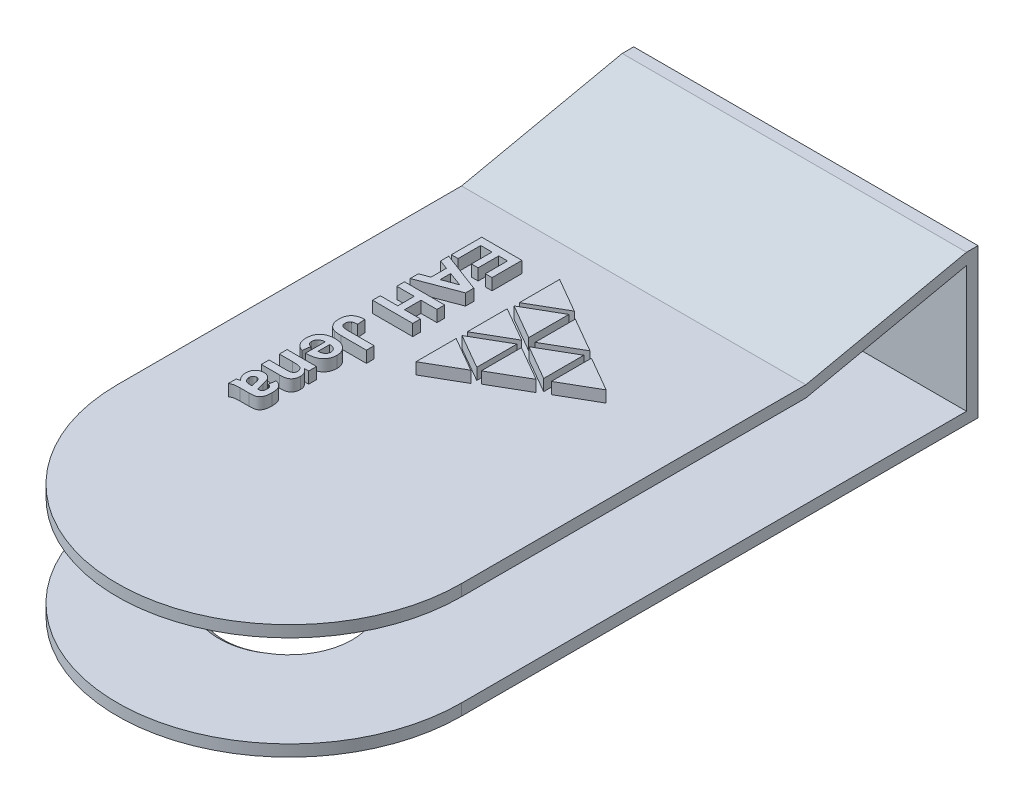
from build123d import *

# Parameters (mm, degrees)
SKIZZE1_W                       = 30
SKIZZE1_H                       = 45
AUFSATZ_LINEAR_AUSTRAGEN1_DEPTH = 1
SKIZZE2_W                       = 30
SKIZZE2_H                       = 1
AUFSATZ_LINEAR_AUSTRAGEN2_DEPTH = 11
SKIZZE3_W                       = 30
SKIZZE3_H                       = 30
AUFSATZ_LINEAR_AUSTRAGEN3_DEPTH = 1
AUFSATZ_LINEAR_AUSTRAGEN4_DEPTH = 30
SKIZZE6_R                       = 8
AUFSATZ_LINEAR_AUSTRAGEN5_DEPTH = 1
SKIZZE7_R                       = 6.3
SCHNITT_LINEAR_AUSTRAGEN1_DEPTH = 2
GEWINDE1_PITCH                  = 1.5
SKIZZE10_R                      = 12.632804719
SCHNITT_LINEAR_AUSTRAGEN2_DEPTH = 5
SKIZZE11_R                      = 16.474015788
SCHNITT_LINEAR_AUSTRAGEN3_DEPTH = 5
AUFSATZ_LINEAR_AUSTRAGEN6_DEPTH = 1
AUFSATZ_LINEAR_AUSTRAGEN7_DEPTH = 1


with BuildPart() as part:
    # Skizze1 → Aufsatz-Linear austragen1 (new body)
    with BuildSketch(Plane(origin=(0, 0, 0), x_dir=(1, 0, 0), z_dir=(0, 1, 0))):
        Rectangle(SKIZZE1_W, SKIZZE1_H)
        with BuildLine():
            ThreePointArc((15, -22.5), (0, -37.5), (-15, -22.5))
            Line((-15, -22.5), (15, -22.5))
        make_face()
    extrude(amount=AUFSATZ_LINEAR_AUSTRAGEN1_DEPTH)

    # Skizze2 → Aufsatz-Linear austragen2 (add)
    with BuildSketch(Plane(origin=(0, 1, 0), x_dir=(1, 0, 0), z_dir=(0, 1, 0))):
        with Locations((0, 22)):
            Rectangle(SKIZZE2_W, SKIZZE2_H)
    extrude(amount=AUFSATZ_LINEAR_AUSTRAGEN2_DEPTH)



with BuildPart() as body_2:
    # Skizze3 → Aufsatz-Linear austragen3 (new body)
    with BuildSketch(Plane(origin=(0, 9, 0), x_dir=(1, 0, 0), z_dir=(0, 1, 0))):
        with Locations((0, -7.5)):
            Rectangle(SKIZZE3_W, SKIZZE3_H)
        with BuildLine():
            ThreePointArc((15, -22.5), (0, -37.5), (-15, -22.5))
            Line((-15, -22.5), (15, -22.5))
        make_face()
    extrude(amount=AUFSATZ_LINEAR_AUSTRAGEN3_DEPTH)


with BuildPart() as part_1:
    add(part.part)

    add(body_2.part)  # Aufsatz-Linear austragen4 merges body 2
    # Skizze5 → Aufsatz-Linear austragen4 (add)
    with BuildSketch(Plane(origin=(15, 0, 0), x_dir=(0, 0, -1), z_dir=(1, 0, 0))):
        Polygon((7.5, 9), (21.5, 12), (22.5, 12), (22.5, 13), (21.5, 13), (7.5, 10), align=None)
    extrude(amount=-AUFSATZ_LINEAR_AUSTRAGEN4_DEPTH)

    # Skizze6 → Aufsatz-Linear austragen5 (add)
    with BuildSketch(Plane.XZ):
        with Locations(Location((0, 22.5, 0), (0, 0, 90))):
            Circle(SKIZZE6_R)
    extrude(amount=AUFSATZ_LINEAR_AUSTRAGEN5_DEPTH)

    # Skizze7 → Schnitt-Linear austragen1 (cut)
    with BuildSketch(Plane(origin=(0, -1, 0), x_dir=(-1, 0, 0), z_dir=(0, -1, 0))):
        with Locations(Location((0, -22.5, 0), (0, 0, 90))):
            Circle(SKIZZE7_R)
    extrude(amount=-SCHNITT_LINEAR_AUSTRAGEN1_DEPTH, mode=Mode.SUBTRACT)

    # Gewinde1: the profile of Gewindeprofil1 profile screwed along a right-hand helix of 2.666667 turns, 8 arcs to a turn; built about Z, then put on its axis
    gewinde1_z = Axis((0, 0, 0), (0, 0, 1))
    gewinde1_corners = [(6.3003, 0, -0.000173205), (6.3003, 0, 1.312673201), (5.488101188, 0, 0.843749998), (5.488101188, 0, 0.468749998)]
    with BuildLine(mode=Mode.PRIVATE) as gewinde1_profile:
        Line(gewinde1_corners[0], gewinde1_corners[1])
        Line(gewinde1_corners[1], gewinde1_corners[2])
        Line(gewinde1_corners[2], gewinde1_corners[3])
        Line(gewinde1_corners[3], gewinde1_corners[0])
    gewinde1_cap = Face(gewinde1_profile.wire())
    gewinde1_turn_angles = [0, 22.5, 45, 67.5, 90, 112.5, 135, 157.5, 180, 202.5, 225, 247.5, 270, 292.5, 315, 337.5, 360]
    gewinde1_turn_weights = [1, 0.9238795325112867, 1, 0.9238795325112867, 1, 0.9238795325112867, 1, 0.9238795325112867, 1, 0.9238795325112867, 1, 0.9238795325112867, 1, 0.9238795325112867, 1, 0.9238795325112867, 1]
    gewinde1_turn_rails = [Edge.make_bspline([Vector(p[0], p[1], 0).rotate(gewinde1_z, gewinde1_turn_angles[k]) / gewinde1_turn_weights[k] + Vector(0, 0, p[2] + GEWINDE1_PITCH * gewinde1_turn_angles[k] / 360) for k in range(17)], [0, 0, 0, 1, 1, 2, 2, 3, 3, 4, 4, 5, 5, 6, 6, 7, 7, 8, 8, 8], 2, gewinde1_turn_weights) for p in gewinde1_corners]
    gewinde1_turn_sides = [Face.make_surface_from_curves(gewinde1_turn_rails[p[0]], gewinde1_turn_rails[p[1]]) for p in [(0, 1), (1, 2), (2, 3), (3, 0)]]
    gewinde1_last_angles = [720, 742.5, 765, 787.5, 810, 832.5, 855, 877.5, 900, 922.5, 945, 952.5, 960]
    gewinde1_last_weights = [1, 0.9238795325112867, 1, 0.9238795325112867, 1, 0.9238795325112867, 1, 0.9238795325112867, 1, 0.9238795325112867, 1, 0.9914448613738105, 1]
    gewinde1_last_rails = [Edge.make_bspline([Vector(p[0], p[1], 0).rotate(gewinde1_z, gewinde1_last_angles[k]) / gewinde1_last_weights[k] + Vector(0, 0, p[2] + GEWINDE1_PITCH * gewinde1_last_angles[k] / 360) for k in range(13)], [0, 0, 0, 1, 1, 2, 2, 3, 3, 4, 4, 5, 5, 6, 6, 6], 2, gewinde1_last_weights) for p in gewinde1_corners]
    gewinde1_last_sides = [Face.make_surface_from_curves(gewinde1_last_rails[p[0]], gewinde1_last_rails[p[1]]) for p in [(0, 1), (1, 2), (2, 3), (3, 0)]]
    gewinde1 = Plane(origin=(0, -2.6, 22.5), x_dir=(1, 0, 0), z_dir=(0, 1, 0)) * Solid(Shell([*[p.moved(Location((0, 0, GEWINDE1_PITCH * i))) for i in range(2) for p in gewinde1_turn_sides], *gewinde1_last_sides, gewinde1_cap, gewinde1_cap.rotate(gewinde1_z, 960).moved(Location((0, 0, GEWINDE1_PITCH * 960 / 360)))]))
    add(gewinde1)

    # Skizze10 → Schnitt-Linear austragen2 (cut)
    with BuildSketch(Plane.XZ.offset(1)):
        with Locations((0, 22.5)):
            Circle(SKIZZE10_R)
    extrude(amount=SCHNITT_LINEAR_AUSTRAGEN2_DEPTH, mode=Mode.SUBTRACT)

    # Skizze11 → Schnitt-Linear austragen3 (cut)
    with BuildSketch(Plane(origin=(0, 1, 0), x_dir=(1, 0, 0), z_dir=(0, 1, 0))):
        with Locations((0.314523005, -22.5)):
            Circle(SKIZZE11_R)
    extrude(amount=SCHNITT_LINEAR_AUSTRAGEN3_DEPTH, mode=Mode.SUBTRACT)

    # Skizze13 → Aufsatz-Linear austragen6 (add)
    # profile 1 of 7: a face of its own
    with BuildSketch(Plane(origin=(0, 10, 0), x_dir=(1, 0, 0), z_dir=(0, 1, 0))):
        with BuildLine():
            Line((-7.461538462, -16.855769231), (-7.371794872, -16.272435897))
            add(Edge.make_bspline(
                [(-7.371794872, -16.272435897), (-7.342228568, -16.281177988), (-7.284353131, -16.298290453), (-7.201417105, -16.329692101), (-7.124742821, -16.366463113), (-7.053414279, -16.407016325), (-6.988211238, -16.452601317), (-6.928964081, -16.502489503), (-6.87587558, -16.556962832), (-6.828534738, -16.616281643), (-6.78648002, -16.681587167), (-6.750825989, -16.754361852), (-6.720804789, -16.834496629), (-6.696678262, -16.921878985), (-6.676507552, -17.016362316), (-6.664159349, -17.118669812), (-6.655245863, -17.228141607), (-6.654321879, -17.303531989), (-6.653846154, -17.342347756)],
                knots=[0, 0, 0, 0, 1.047140172, 2.049755565, 3.008539736, 3.933190086, 4.833981818, 5.707167246, 6.560530269, 7.413560864, 8.281243119, 9.193714071, 10.161006392, 11.183910126, 12.270717139, 13.439589873, 14.681737877, 16, 16, 16, 16], degree=3))
            add(Edge.make_bspline(
                [(-6.653846154, -17.342347756), (-6.654040458, -17.377644162), (-6.654416405, -17.445937161), (-6.659409822, -17.544869412), (-6.667464028, -17.636617681), (-6.679750029, -17.721457439), (-6.693817921, -17.799572387), (-6.712099932, -17.870796197), (-6.733529165, -17.93496193), (-6.766861986, -18.009101075), (-6.813711555, -18.090520093), (-6.877263393, -18.175577918), (-6.949862734, -18.243647865), (-7.017034313, -18.28945705), (-7.078235395, -18.316410266), (-7.132561048, -18.333813561), (-7.195063387, -18.34914792), (-7.266650154, -18.360460763), (-7.346098661, -18.370614864), (-7.434603024, -18.376239354), (-7.531370038, -18.38075665), (-7.59895166, -18.381186988), (-7.634014423, -18.381410256)],
                knots=[0, 0, 0, 0, 1.253089278, 2.424530831, 3.516103812, 4.521791402, 5.467348922, 6.332758186, 7.130477226, 7.865998692, 9.215316109, 10.458392318, 11.620687606, 12.7345829, 13.32519123, 13.989073223, 14.757870489, 15.607744835, 16.560809343, 17.600728964, 18.755207866, 20, 20, 20, 20], degree=3))
            Line((-7.634014423, -18.381410256), (-8.419971955, -18.381410256))
            add(Edge.make_bspline(
                [(-8.419971955, -18.381410256), (-8.447080442, -18.38163882), (-8.499431254, -18.382080213), (-8.575204963, -18.38280215), (-8.645254702, -18.387187846), (-8.709880154, -18.389714647), (-8.768944245, -18.395940559), (-8.822574056, -18.40172905), (-8.870770752, -18.409499087), (-8.928361612, -18.421761672), (-8.998019943, -18.441867703), (-9.082273661, -18.472969466), (-9.168931941, -18.513158905), (-9.226671678, -18.544668545), (-9.256410256, -18.560897436)],
                knots=[0, 0, 0, 0, 1.124133555, 2.170881208, 3.141136401, 4.03397314, 4.851653906, 5.602897914, 6.270414243, 6.874806075, 8.043499627, 9.272964875, 10.595453442, 12, 12, 12, 12], degree=3))
            Line((-9.256410256, -18.560897436), (-9.256410256, -17.887820513))
            add(Edge.make_bspline(
                [(-9.256410256, -17.887820513), (-9.242897242, -17.883016373), (-9.213287459, -17.872489517), (-9.163653559, -17.858272961), (-9.105824046, -17.841235347), (-9.064095786, -17.83000231), (-9.041866987, -17.824018429)],
                knots=[0, 0, 0, 0, 0.768508203, 1.683958961, 2.766236402, 4, 4, 4, 4], degree=3))
            add(Edge.make_bspline(
                [(-9.041866987, -17.824018429), (-9.032014411, -17.821579315), (-9.014119373, -17.817149199), (-8.990388596, -17.809388151), (-8.97155602, -17.805294393), (-8.961216976, -17.801654063), (-8.95703125, -17.800180288)],
                knots=[0, 0, 0, 0, 1.38134116, 2.508902287, 3.396334264, 4, 4, 4, 4], degree=3))
            add(Edge.make_bspline(
                [(-8.95703125, -17.800180288), (-8.984483486, -17.771706237), (-9.0382029, -17.715987303), (-9.10777297, -17.625113764), (-9.167671581, -17.53227479), (-9.216528902, -17.435953528), (-9.254891933, -17.336694325), (-9.281193716, -17.23381568), (-9.298031659, -17.127889616), (-9.300190492, -17.056120156), (-9.301282051, -17.019831731)],
                knots=[0, 0, 0, 0, 1.082278699, 2.117837564, 3.127951196, 4.103896207, 5.070141411, 6.035602179, 7.006751569, 8, 8, 8, 8], degree=3))
            add(Edge.make_bspline(
                [(-9.301282051, -17.019831731), (-9.300551328, -16.988261576), (-9.299124118, -16.926600357), (-9.289695712, -16.836623652), (-9.271815335, -16.752045612), (-9.248030246, -16.672484102), (-9.218145083, -16.597727557), (-9.180534672, -16.528488617), (-9.136417111, -16.464261666), (-9.084873908, -16.406412303), (-9.029167654, -16.353877064), (-8.969265829, -16.308052451), (-8.905712194, -16.269006303), (-8.838305422, -16.237687717), (-8.767453749, -16.212697126), (-8.693135324, -16.195520674), (-8.615209989, -16.184555758), (-8.562103969, -16.183322669), (-8.534955929, -16.182692308)],
                knots=[0, 0, 0, 0, 1.18658458, 2.31757657, 3.394226474, 4.430715881, 5.435456892, 6.414057866, 7.386212409, 8.35709637, 9.320281587, 10.260156395, 11.186596348, 12.117853754, 13.048448167, 14.005042754, 14.980168739, 16, 16, 16, 16], degree=3))
            add(Edge.make_bspline(
                [(-8.534955929, -16.182692308), (-8.499362275, -16.183939807), (-8.429562987, -16.186386157), (-8.327694138, -16.204577763), (-8.232177791, -16.23673606), (-8.142928174, -16.280105499), (-8.06149932, -16.334583062), (-7.989631341, -16.400003093), (-7.928168256, -16.475615445), (-7.876606032, -16.563377641), (-7.832723617, -16.665636684), (-7.790287228, -16.784863762), (-7.752647697, -16.924314043), (-7.730998836, -17.024399966), (-7.719551282, -17.077323718)],
                knots=[0, 0, 0, 0, 0.956565251, 1.875828012, 2.769799286, 3.657635185, 4.535794535, 5.394066738, 6.260416921, 7.14495727, 8.120882861, 9.247498621, 10.544523601, 12, 12, 12, 12], degree=3))
            add(Edge.make_bspline(
                [(-7.719551282, -17.077323718), (-7.712132971, -17.113794602), (-7.697852982, -17.183999772), (-7.676337014, -17.284834233), (-7.654863859, -17.376776028), (-7.63247901, -17.45969484), (-7.612876557, -17.534591783), (-7.592592957, -17.600571463), (-7.572345631, -17.657613361), (-7.557957507, -17.692259194), (-7.551282051, -17.708333333)],
                knots=[0, 0, 0, 0, 1.365617471, 2.628765604, 3.783168753, 4.829402825, 5.780074121, 6.623651276, 7.361434847, 8, 8, 8, 8], degree=3))
            Line((-7.551282051, -17.708333333), (-7.487479968, -17.708333333))
            add(Edge.make_bspline(
                [(-7.487479968, -17.708333333), (-7.458881578, -17.707430868), (-7.405772743, -17.705754939), (-7.332057391, -17.689262951), (-7.271720541, -17.660371446), (-7.230837496, -17.626426085), (-7.206638597, -17.592123281), (-7.190200311, -17.561669993), (-7.177581988, -17.525784147), (-7.165905401, -17.485396417), (-7.158100407, -17.439751277), (-7.151571999, -17.389253402), (-7.148378817, -17.333739962), (-7.147758794, -17.295141434), (-7.147435897, -17.275040064)],
                knots=[0, 0, 0, 0, 1.600017626, 2.971323677, 4.194571328, 5.31736933, 5.898517236, 6.536691297, 7.248930295, 8.023708211, 8.888724419, 9.83830628, 10.874231527, 12, 12, 12, 12], degree=3))
            add(Edge.make_bspline(
                [(-7.147435897, -17.275040064), (-7.148105155, -17.248336308), (-7.14938268, -17.197362324), (-7.162610143, -17.125735408), (-7.184310446, -17.062932274), (-7.21586982, -17.008539641), (-7.259037342, -16.961516134), (-7.314665433, -16.92056097), (-7.383036587, -16.884282018), (-7.434386761, -16.865631042), (-7.461538462, -16.855769231)],
                knots=[0, 0, 0, 0, 1.120624541, 2.139125895, 3.045753857, 3.899333821, 4.761059621, 5.707367731, 6.787757473, 8, 8, 8, 8], degree=3))
        make_face()
        with BuildLine():
            add(Edge.make_bspline(
                [(-8.044871795, -17.708333333), (-8.052008257, -17.685233208), (-8.068081471, -17.63320557), (-8.091569637, -17.546016977), (-8.116693521, -17.440970365), (-8.138009131, -17.344010664), (-8.155711696, -17.262741023), (-8.169576028, -17.205422407), (-8.183799139, -17.153808711), (-8.197454974, -17.107864753), (-8.211613494, -17.067422328), (-8.225531669, -17.032878753), (-8.238365234, -17.003286764), (-8.248936791, -16.986772978), (-8.25380609, -16.979166667)],
                knots=[0, 0, 0, 0, 1.144251806, 2.577159925, 4.272729571, 6.25595871, 7.275767821, 8.209390473, 9.046628288, 9.809462825, 10.477647263, 11.07332096, 11.573168194, 12, 12, 12, 12], degree=3))
            add(Edge.make_bspline(
                [(-8.25380609, -16.979166667), (-8.268632797, -16.960341609), (-8.297087078, -16.924214), (-8.352074366, -16.884830719), (-8.413035927, -16.859839552), (-8.456189511, -16.857142619), (-8.478165064, -16.855769231)],
                knots=[0, 0, 0, 0, 1.075028234, 2.063111864, 3.013658082, 4, 4, 4, 4], degree=3))
            add(Edge.make_bspline(
                [(-8.478165064, -16.855769231), (-8.500030113, -16.856980636), (-8.542920059, -16.8593569), (-8.604725482, -16.878281742), (-8.661337979, -16.910111518), (-8.711708385, -16.953441844), (-8.75501993, -17.0054995), (-8.785449465, -17.066730628), (-8.804289489, -17.134643152), (-8.80653276, -17.182364207), (-8.807692308, -17.20703125)],
                knots=[0, 0, 0, 0, 0.97671936, 1.915908908, 2.861187175, 3.862381481, 4.872972798, 5.868749731, 6.898355403, 8, 8, 8, 8], degree=3))
            add(Edge.make_bspline(
                [(-8.807692308, -17.20703125), (-8.80641627, -17.235231993), (-8.803847367, -17.292005414), (-8.780375313, -17.375271116), (-8.7457309, -17.457480238), (-8.711634914, -17.507397088), (-8.694110577, -17.533052885)],
                knots=[0, 0, 0, 0, 0.962503947, 1.937702252, 2.940039444, 4, 4, 4, 4], degree=3))
            add(Edge.make_bspline(
                [(-8.694110577, -17.533052885), (-8.679523572, -17.551171955), (-8.651161485, -17.586401576), (-8.599332491, -17.628390335), (-8.544198801, -17.663040369), (-8.503525788, -17.676849831), (-8.483072917, -17.683794071)],
                knots=[0, 0, 0, 0, 1.055399509, 2.052054707, 3.020454315, 4, 4, 4, 4], degree=3))
            add(Edge.make_bspline(
                [(-8.483072917, -17.683794071), (-8.466300179, -17.687621301), (-8.427037401, -17.696580346), (-8.357917039, -17.70290117), (-8.270950301, -17.708014319), (-8.206845082, -17.708220524), (-8.17177484, -17.708333333)],
                knots=[0, 0, 0, 0, 0.659054705, 1.542760655, 2.655710416, 4, 4, 4, 4], degree=3))
            Line((-8.17177484, -17.708333333), (-8.044871795, -17.708333333))
        make_face(mode=Mode.SUBTRACT)
    # profile 2 of 7: a face of its own
    with BuildSketch(Plane(origin=(0, 10, 0), x_dir=(1, 0, 0), z_dir=(0, 1, 0))):
        with BuildLine():
            Line((-9.256410256, -15.689102564), (-9.256410256, -15.016025641))
            Line((-9.256410256, -15.016025641), (-7.943910256, -15.016025641))
            add(Edge.make_bspline(
                [(-7.943910256, -15.016025641), (-7.910721892, -15.015925334), (-7.847376132, -15.015733879), (-7.757166968, -15.013384233), (-7.676040389, -15.010873271), (-7.604261412, -15.006770224), (-7.541333264, -15.001328948), (-7.487813208, -14.994300447), (-7.443189581, -14.987084715), (-7.396757732, -14.975097512), (-7.347814596, -14.955607704), (-7.296662138, -14.925600379), (-7.251427054, -14.890512349), (-7.214393717, -14.848100193), (-7.184538177, -14.800544647), (-7.162526665, -14.748336453), (-7.149673429, -14.691086988), (-7.148196886, -14.651508139), (-7.147435897, -14.631109776)],
                knots=[0, 0, 0, 0, 1.58488548, 3.025029391, 4.309307756, 5.460828077, 6.458151993, 7.324757442, 8.038530954, 8.61512886, 9.612015531, 10.54232765, 11.439998968, 12.333497636, 13.216055091, 14.111503416, 15.026696281, 16, 16, 16, 16], degree=3))
            add(Edge.make_bspline(
                [(-7.147435897, -14.631109776), (-7.148748817, -14.604851046), (-7.151334312, -14.553140505), (-7.168933091, -14.477349195), (-7.20079289, -14.406828043), (-7.242564177, -14.340697963), (-7.295066383, -14.282425502), (-7.355540168, -14.231951218), (-7.424799526, -14.192922072), (-7.489155052, -14.16848051), (-7.54744887, -14.154013921), (-7.600092432, -14.144161817), (-7.661521631, -14.137105487), (-7.731109175, -14.129651443), (-7.809510771, -14.125446929), (-7.895950085, -14.120755381), (-7.991112861, -14.119028067), (-8.057258557, -14.118740248), (-8.091846955, -14.118589744)],
                knots=[0, 0, 0, 0, 1.03258592, 2.033440909, 3.037455237, 4.062282952, 5.09715643, 6.109088545, 7.14636667, 8.207988388, 8.805331503, 9.506478866, 10.312364985, 11.235937909, 12.258042538, 13.39892264, 14.639864631, 16, 16, 16, 16], degree=3))
            Line((-8.091846955, -14.118589744), (-9.256410256, -14.118589744))
            Line((-9.256410256, -14.118589744), (-9.256410256, -13.445512821))
            Line((-9.256410256, -13.445512821), (-6.698717949, -13.445512821))
            Line((-6.698717949, -13.445512821), (-6.698717949, -14.118589744))
            Line((-6.698717949, -14.118589744), (-7.067508013, -14.118589744))
            add(Edge.make_bspline(
                [(-7.067508013, -14.118589744), (-7.034720531, -14.144611736), (-6.970847536, -14.195304945), (-6.885959251, -14.280174612), (-6.813917938, -14.370059445), (-6.755111388, -14.465364813), (-6.709718612, -14.566041826), (-6.677748575, -14.671629371), (-6.657066673, -14.782214472), (-6.654932344, -14.857712038), (-6.653846154, -14.896133814)],
                knots=[0, 0, 0, 0, 1.096260936, 2.135615983, 3.138008533, 4.108575778, 5.062498258, 6.023394349, 6.994077526, 8, 8, 8, 8], degree=3))
            add(Edge.make_bspline(
                [(-6.653846154, -14.896133814), (-6.654688482, -14.929852557), (-6.65634727, -14.99625455), (-6.672488329, -15.093537606), (-6.697454412, -15.186500791), (-6.7324294, -15.273626167), (-6.774934934, -15.35322407), (-6.823183682, -15.423942436), (-6.87742841, -15.484408608), (-6.938011924, -15.533906073), (-7.002997177, -15.574443554), (-7.071804537, -15.608529408), (-7.144822629, -15.635886291), (-7.224450591, -15.656752106), (-7.314654488, -15.670971486), (-7.419449471, -15.682280595), (-7.541404293, -15.687993064), (-7.628401155, -15.688717303), (-7.674679487, -15.689102564)],
                knots=[0, 0, 0, 0, 1.087237855, 2.141086966, 3.172903477, 4.188189852, 5.163243972, 6.07948016, 6.944405198, 7.774811094, 8.594983603, 9.411159232, 10.2487933, 11.106686982, 12.062567107, 13.192689343, 14.506639757, 16, 16, 16, 16], degree=3))
            Line((-7.674679487, -15.689102564), (-9.256410256, -15.689102564))
        make_face()
    # profile 3 of 7: a face of its own
    with BuildSketch(Plane(origin=(0, 10, 0), x_dir=(1, 0, 0), z_dir=(0, 1, 0))):
        with BuildLine():
            Line((-8.448717949, -12.189102564), (-8.538461538, -12.862179487))
            add(Edge.make_bspline(
                [(-8.538461538, -12.862179487), (-8.568787149, -12.851170374), (-8.628413763, -12.829524109), (-8.713434132, -12.789976243), (-8.792784786, -12.745769512), (-8.866889692, -12.697116444), (-8.935845536, -12.644198103), (-8.998201779, -12.585264683), (-9.056279736, -12.523187147), (-9.107313924, -12.455368816), (-9.153210578, -12.383508974), (-9.193369664, -12.307246491), (-9.226075661, -12.225971481), (-9.25346472, -12.140914709), (-9.275326702, -12.051690093), (-9.290610376, -11.957933615), (-9.299896286, -11.859765562), (-9.300814309, -11.792755906), (-9.301282051, -11.758613782)],
                knots=[0, 0, 0, 0, 1.071172907, 2.106154283, 3.1104349, 4.085737425, 5.048416355, 5.993087888, 6.932482331, 7.868664062, 8.80754521, 9.762367971, 10.726735429, 11.713584758, 12.728370439, 13.774815933, 14.866245336, 16, 16, 16, 16], degree=3))
            add(Edge.make_bspline(
                [(-9.301282051, -11.758613782), (-9.299961745, -11.705262395), (-9.29739781, -11.601658062), (-9.276895213, -11.451743641), (-9.243220642, -11.312375958), (-9.196897811, -11.183325495), (-9.134829308, -11.065629138), (-9.060341781, -10.958404764), (-8.972113427, -10.861546489), (-8.903837495, -10.807244243), (-8.869391026, -10.779847756)],
                knots=[0, 0, 0, 0, 1.15090686, 2.234973544, 3.257507168, 4.240282073, 5.185422152, 6.119941203, 7.051475585, 8, 8, 8, 8], degree=3))
            add(Edge.make_bspline(
                [(-8.869391026, -10.779847756), (-8.840073177, -10.759636155), (-8.781035589, -10.718935891), (-8.685409387, -10.668235896), (-8.584178597, -10.625293635), (-8.477865017, -10.589425528), (-8.365451188, -10.562213512), (-8.247613825, -10.542534452), (-8.123840194, -10.531534691), (-8.039517262, -10.529754457), (-7.996494391, -10.528846154)],
                knots=[0, 0, 0, 0, 0.924739034, 1.862154457, 2.806332648, 3.78003102, 4.774289357, 5.808656063, 6.881942244, 8, 8, 8, 8], degree=3))
            add(Edge.make_bspline(
                [(-7.996494391, -10.528846154), (-7.945506085, -10.529695292), (-7.845854688, -10.531354846), (-7.70070706, -10.546976564), (-7.563900579, -10.572653055), (-7.43599263, -10.609079301), (-7.316379831, -10.655549182), (-7.20519299, -10.712191224), (-7.102725726, -10.780034423), (-7.009792902, -10.857832035), (-6.92653693, -10.943403101), (-6.853118689, -11.034363206), (-6.791808901, -11.131517511), (-6.74063331, -11.233386819), (-6.702328131, -11.341674603), (-6.674130253, -11.455023298), (-6.656958182, -11.573929115), (-6.654894377, -11.655024806), (-6.653846154, -11.696213942)],
                knots=[0, 0, 0, 0, 1.22208028, 2.38843015, 3.495001974, 4.555551, 5.572102979, 6.566928721, 7.541284444, 8.51191166, 9.466805643, 10.399597494, 11.308905182, 12.215983304, 13.126946664, 14.056451325, 15.012856426, 16, 16, 16, 16], degree=3))
            add(Edge.make_bspline(
                [(-6.653846154, -11.696213942), (-6.654820842, -11.742312924), (-6.656728203, -11.832523801), (-6.674633609, -11.964051338), (-6.703758804, -12.088234433), (-6.745604427, -12.204674528), (-6.79809638, -12.314105277), (-6.863077674, -12.415806737), (-6.940383725, -12.509558017), (-7.028566011, -12.596216033), (-7.129608768, -12.672958221), (-7.242836003, -12.739247195), (-7.368558666, -12.794512274), (-7.50663564, -12.839397424), (-7.657454783, -12.872558378), (-7.820594752, -12.895254643), (-7.996049061, -12.908196353), (-8.117066236, -12.907440931), (-8.179487179, -12.907051282)],
                knots=[0, 0, 0, 0, 0.994914541, 1.946943474, 2.860007193, 3.744253739, 4.613162343, 5.475451996, 6.343187588, 7.231728884, 8.139057486, 9.075471918, 10.058180036, 11.098621179, 12.205332334, 13.387827392, 14.65263521, 16, 16, 16, 16], degree=3))
            Line((-8.179487179, -12.907051282), (-8.179487179, -11.201923077))
            add(Edge.make_bspline(
                [(-8.179487179, -11.201923077), (-8.203575679, -11.203035136), (-8.250483713, -11.205200673), (-8.319094779, -11.213229113), (-8.383087663, -11.227714628), (-8.443754476, -11.244755909), (-8.499504694, -11.268024193), (-8.551458066, -11.295627972), (-8.599333934, -11.327865087), (-8.642641825, -11.365004779), (-8.681062348, -11.405708244), (-8.714878734, -11.448628066), (-8.744153694, -11.493638357), (-8.767194599, -11.541848436), (-8.785642462, -11.592267213), (-8.798003322, -11.645264938), (-8.806040434, -11.700409822), (-8.807134146, -11.738018469), (-8.807692308, -11.757211538)],
                knots=[0, 0, 0, 0, 1.231638706, 2.398395625, 3.522289669, 4.579947828, 5.613000372, 6.600997726, 7.58103015, 8.554716894, 9.508889492, 10.435482506, 11.342805004, 12.245087657, 13.158904806, 14.079635201, 15.019967576, 16, 16, 16, 16], degree=3))
            add(Edge.make_bspline(
                [(-8.807692308, -11.757211538), (-8.806559527, -11.782758898), (-8.804365499, -11.832240322), (-8.788993068, -11.903564467), (-8.761902756, -11.968279163), (-8.724135646, -12.027062518), (-8.673980876, -12.079367997), (-8.610098642, -12.123220722), (-8.534483277, -12.161562415), (-8.478247023, -12.179620468), (-8.448717949, -12.189102564)],
                knots=[0, 0, 0, 0, 1.004430367, 1.945431754, 2.851730883, 3.749038912, 4.678525969, 5.68064125, 6.782128749, 8, 8, 8, 8], degree=3))
        make_face()
        with BuildLine():
            add(Edge.make_bspline(
                [(-7.775641026, -12.233974359), (-7.750851307, -12.23282457), (-7.702571598, -12.230585277), (-7.632223712, -12.22310711), (-7.56643029, -12.210878432), (-7.505709739, -12.192835649), (-7.449246827, -12.172015785), (-7.397025832, -12.14695615), (-7.349781098, -12.116686563), (-7.307896431, -12.081888005), (-7.269587596, -12.045218126), (-7.237787709, -12.004646674), (-7.209013446, -11.963554963), (-7.186817343, -11.919692638), (-7.168848137, -11.874244594), (-7.156254643, -11.826732323), (-7.149348426, -11.777043744), (-7.148080457, -11.743442848), (-7.147435897, -11.726362179)],
                knots=[0, 0, 0, 0, 1.317155349, 2.565252013, 3.752617023, 4.863710936, 5.923691592, 6.944619286, 7.932291025, 8.893346204, 9.832040666, 10.740742434, 11.625065814, 12.490654946, 13.343074709, 14.215747339, 15.092993572, 16, 16, 16, 16], degree=3))
            add(Edge.make_bspline(
                [(-7.147435897, -11.726362179), (-7.148028374, -11.708109846), (-7.149195878, -11.672142712), (-7.156813628, -11.619397982), (-7.170325035, -11.569403702), (-7.188612042, -11.521778865), (-7.212694115, -11.476625533), (-7.242227806, -11.433942696), (-7.276843359, -11.393569778), (-7.303068423, -11.369243245), (-7.31640625, -11.356870994)],
                knots=[0, 0, 0, 0, 1.043516863, 2.056302107, 3.038302912, 3.998520634, 4.966791607, 5.956307719, 6.960596886, 8, 8, 8, 8], degree=3))
            add(Edge.make_bspline(
                [(-7.31640625, -11.356870994), (-7.330908397, -11.345345088), (-7.360045017, -11.322188108), (-7.408317374, -11.292713426), (-7.46013981, -11.26743649), (-7.516044545, -11.246988642), (-7.575719556, -11.231669853), (-7.639101955, -11.221447048), (-7.70609353, -11.214941838), (-7.752020677, -11.214215634), (-7.775641026, -11.213842147)],
                knots=[0, 0, 0, 0, 0.903766344, 1.81577923, 2.754803886, 3.715080786, 4.716965023, 5.758108642, 6.846994466, 8, 8, 8, 8], degree=3))
            Line((-7.775641026, -11.213842147), (-7.775641026, -12.233974359))
        make_face(mode=Mode.SUBTRACT)
    # profile 4 of 7: a face of its own
    with BuildSketch(Plane(origin=(0, 10, 0), x_dir=(1, 0, 0), z_dir=(0, 1, 0))):
        with BuildLine():
            Line((-5.756410256, -9.362179487), (-5.756410256, -10.03525641))
            Line((-5.756410256, -10.03525641), (-7.962840545, -10.03525641))
            add(Edge.make_bspline(
                [(-7.962840545, -10.03525641), (-7.997899929, -10.034955629), (-8.065932917, -10.034371961), (-8.164817907, -10.030785595), (-8.257435375, -10.025449687), (-8.343772027, -10.017241225), (-8.423641224, -10.005675036), (-8.497680061, -9.993417289), (-8.565514333, -9.978534904), (-8.607952171, -9.965198687), (-8.628205128, -9.958834135)],
                knots=[0, 0, 0, 0, 1.251619961, 2.428777588, 3.532126049, 4.56323557, 5.523704531, 6.412540087, 7.242403515, 8, 8, 8, 8], degree=3))
            add(Edge.make_bspline(
                [(-8.628205128, -9.958834135), (-8.653162082, -9.949939392), (-8.702553335, -9.932336183), (-8.773011434, -9.898125034), (-8.839701889, -9.858768979), (-8.902981366, -9.814447529), (-8.962723896, -9.765426416), (-9.018450781, -9.710937041), (-9.070537905, -9.651340927), (-9.117922934, -9.585853087), (-9.162015334, -9.515947187), (-9.198981141, -9.439575419), (-9.230453259, -9.358158007), (-9.256472369, -9.271428903), (-9.276650153, -9.179306279), (-9.291372637, -9.081896651), (-9.299729699, -8.979047579), (-9.300755996, -8.90880247), (-9.301282051, -8.872796474)],
                knots=[0, 0, 0, 0, 0.925423698, 1.831466936, 2.732229661, 3.629578708, 4.52900719, 5.430103168, 6.350647525, 7.291692347, 8.252765748, 9.235429742, 10.251737562, 11.300896807, 12.396835199, 13.545097772, 14.74167469, 16, 16, 16, 16], degree=3))
            add(Edge.make_bspline(
                [(-9.301282051, -8.872796474), (-9.300264761, -8.830695845), (-9.298287057, -8.748848423), (-9.285150064, -8.629829036), (-9.262191518, -8.518206105), (-9.228968293, -8.414356855), (-9.187956748, -8.317260625), (-9.136085543, -8.228401373), (-9.075718065, -8.146532898), (-9.005710517, -8.072504186), (-8.927090237, -8.00634991), (-8.839152606, -7.949168336), (-8.742596276, -7.900927799), (-8.637687155, -7.860772836), (-8.523907441, -7.83021369), (-8.401765926, -7.807881697), (-8.270922148, -7.794633463), (-8.180920068, -7.792674515), (-8.134615385, -7.791666667)],
                knots=[0, 0, 0, 0, 1.114288914, 2.166278188, 3.164727497, 4.125283685, 5.047987165, 5.948762093, 6.842007947, 7.734696741, 8.639180976, 9.555371443, 10.504244498, 11.491071546, 12.523510359, 13.617893313, 14.774442821, 16, 16, 16, 16], degree=3))
            Line((-8.134615385, -7.791666667), (-8.08974359, -8.46474359))
            add(Edge.make_bspline(
                [(-8.08974359, -8.46474359), (-8.114527792, -8.46596289), (-8.162052889, -8.468300967), (-8.230594316, -8.474599875), (-8.29343803, -8.483199996), (-8.35098771, -8.492319545), (-8.40267139, -8.505220996), (-8.448525014, -8.51980053), (-8.489570844, -8.535537766), (-8.513598003, -8.549285334), (-8.525140224, -8.555889423)],
                knots=[0, 0, 0, 0, 1.326487006, 2.54361322, 3.678027021, 4.717362032, 5.656743531, 6.522084707, 7.290035665, 8, 8, 8, 8], degree=3))
            add(Edge.make_bspline(
                [(-8.525140224, -8.555889423), (-8.540367142, -8.566049222), (-8.570205273, -8.585958007), (-8.609797574, -8.621536266), (-8.644026069, -8.660657489), (-8.67055128, -8.704920501), (-8.691775199, -8.752226442), (-8.707384198, -8.80326606), (-8.716615425, -8.858437002), (-8.717495265, -8.896598393), (-8.717948718, -8.916266026)],
                knots=[0, 0, 0, 0, 1.02328517, 2.005193587, 2.969877287, 3.920988308, 4.881139405, 5.865831409, 6.900091352, 8, 8, 8, 8], degree=3))
            add(Edge.make_bspline(
                [(-8.717948718, -8.916266026), (-8.717582543, -8.935916247), (-8.716878636, -8.973690242), (-8.710477747, -9.028126952), (-8.700105843, -9.07817881), (-8.685526565, -9.123873078), (-8.666600519, -9.16536454), (-8.642387919, -9.201733499), (-8.615143263, -9.234547134), (-8.582369833, -9.262892935), (-8.542880476, -9.287044112), (-8.494816723, -9.307209248), (-8.43798087, -9.324556766), (-8.371940833, -9.337963811), (-8.29732884, -9.349375851), (-8.213485188, -9.356534387), (-8.120657681, -9.361679994), (-8.055630783, -9.362008335), (-8.021734776, -9.362179487)],
                knots=[0, 0, 0, 0, 0.980314827, 1.884477813, 2.730827652, 3.527503874, 4.27366112, 4.998269146, 5.70163477, 6.396145331, 7.150281155, 8.001758491, 8.990432449, 10.111292654, 11.361572691, 12.75538406, 14.308707205, 16, 16, 16, 16], degree=3))
            Line((-8.021734776, -9.362179487), (-5.756410256, -9.362179487))
        make_face()
    # profile 5 of 7: a face of its own
    with BuildSketch(Plane(origin=(0, 10, 0), x_dir=(1, 0, 0), z_dir=(0, 1, 0))):
        Polygon((-9.256410256, -3.21474359), (-5.756410256, -3.21474359), (-5.756410256, -3.887820513), (-7.147435897, -3.887820513), (-7.147435897, -5.323717949), (-5.756410256, -5.323717949), (-5.756410256, -5.996794872), (-9.256410256, -5.996794872), (-9.256410256, -5.323717949), (-7.730769231, -5.323717949), (-7.730769231, -3.887820513), (-9.256410256, -3.887820513), align=None)
    # profile 6 of 7: a face of its own
    with BuildSketch(Plane(origin=(0, 10, 0), x_dir=(1, 0, 0), z_dir=(0, 1, 0))):
        Polygon((-9.256410256, -2.721153846), (-9.256410256, -2.007411859), (-8.448717949, -1.712239583), (-8.448717949, -0.368890224), (-9.256410256, -0.073717949), (-9.256410256, 0.644230769), (-5.756410256, -0.678786058), (-5.756410256, -1.391826923), align=None)
        Polygon((-7.865384615, -1.498397436), (-6.608974359, -1.038461538), (-7.865384615, -0.579927885), align=None, mode=Mode.SUBTRACT)
    # profile 7 of 7: a face of its own
    with BuildSketch(Plane(origin=(0, 10, 0), x_dir=(1, 0, 0), z_dir=(0, 1, 0))):
        Polygon((-9.256410256, 3.516025641), (-5.756410256, 3.516025641), (-5.756410256, 0.913461538), (-6.33974359, 0.913461538), (-6.33974359, 2.842948718), (-7.102564103, 2.842948718), (-7.102564103, 1.048076923), (-7.685897436, 1.048076923), (-7.685897436, 2.842948718), (-8.673076923, 2.842948718), (-8.673076923, 0.868589744), (-9.256410256, 0.868589744), align=None)
    extrude(amount=AUFSATZ_LINEAR_AUSTRAGEN6_DEPTH)

    # Skizze12 → Aufsatz-Linear austragen7 (add)
    with BuildSketch(Plane(origin=(0, 10, 0), x_dir=(1, 0, 0), z_dir=(0, 1, 0))):
        Polygon((-2.675315458, 3.718870699), (-2.675315458, 0.218870699), (0.355773456, 1.968870699), align=None)
        Polygon((-2.748893156, -0.778418789), (-2.748893156, -4.247031174), (0.255013286, -2.512724981), align=None)
        Polygon((-2.724410857, -5.247031174), (-2.724410857, -8.747031174), (0.306678056, -6.997031174), align=None)
        Polygon((1.003427455, 1.406510163), (1.003427455, -2.093489837), (4.034516368, -0.343489837), align=None)
        Polygon((0.809861997, -3.092266529), (0.809861997, -6.592266529), (3.84095091, -4.842266529), align=None)
        Polygon((4.656621865, -0.837524462), (4.656621865, -4.337524462), (7.687710779, -2.587524462), align=None)
        Polygon((4.100429928, -0.9453081), (4.100429928, -4.4453081), (1.069341015, -2.6953081), align=None)
        Polygon((0.368366644, 1.483987295), (0.368366644, -2.016012705), (-2.662722269, -0.266012705), align=None)
        Polygon((0.341459455, -3.015785959), (0.341459455, -6.515785959), (-2.689629458, -4.765785959), align=None)
    extrude(amount=AUFSATZ_LINEAR_AUSTRAGEN7_DEPTH)


solid = part_1.part
